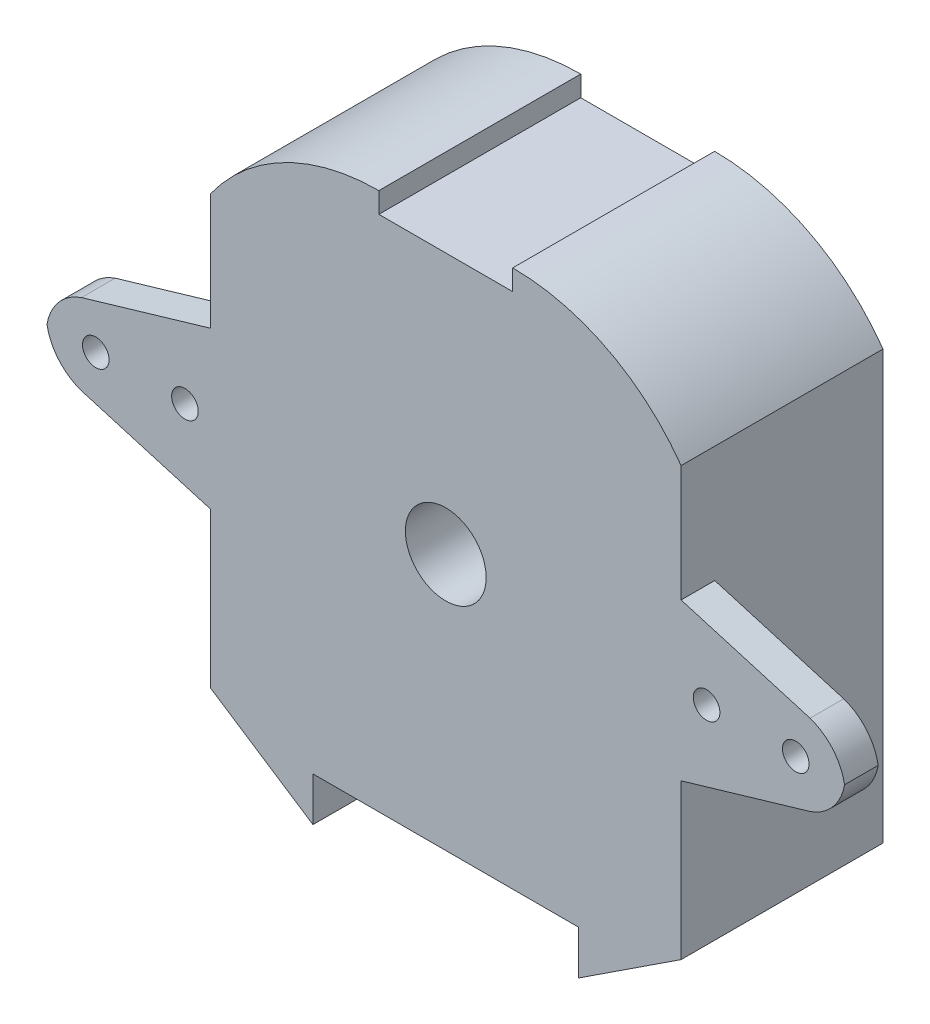
from build123d import *

# Parameters (mm, degrees)
BOSS_EXTRUDE2_DEPTH     = 15.24
SKETCH5_R               = 3.048
CUT_EXTRUDE2_DEPTH      = 15.24
BOSS_EXTRUDE3_DEPTH     = 2.54
CUT_EXTRUDE5_DEPTH      = 41.652633663
CUT_EXTRUDE5_DEPTH_BACK = 41.652633663
SKETCH7_R               = 1.0033


with BuildPart() as part:
    # Sketch1 → Boss-Extrude2 (new body)
    with BuildSketch(Plane.XY):
        with BuildLine():
            Line((-17.763499893, 14.683044609), (-17.763499893, -17.608986031))
            Line((-17.763499893, -17.608986031), (-10.024087591, -22.679635471))
            Line((-10.024087591, -22.679635471), (-10.024087591, -19.359490178))
            Line((-10.024087591, -19.359490178), (10.024087591, -19.359490178))
            Line((10.024087591, -19.359490178), (10.024087591, -22.679635471))
            Line((10.024087591, -22.679635471), (17.763499893, -17.608986031))
            Line((17.763499893, -17.608986031), (17.763499893, 14.683044609))
            ThreePointArc((17.763499893, 14.683044609), (12.2054587, 19.511759091), (5.051122326, 21.250660037))
            Line((5.051122326, 21.250660037), (5.051122326, 19.699745061))
            Line((5.051122326, 19.699745061), (-5.051122326, 19.699745061))
            Line((-5.051122326, 19.699745061), (-5.051122326, 21.250660037))
            ThreePointArc((-5.051122326, 21.250660037), (-12.2054587, 19.511759091), (-17.763499893, 14.683044609))
        make_face()
    extrude(amount=BOSS_EXTRUDE2_DEPTH)

    # Sketch5 → Cut-Extrude2 (cut)
    with BuildSketch(Plane.XY.offset(15.24)):
        Circle(SKETCH5_R)
    extrude(amount=-CUT_EXTRUDE2_DEPTH, mode=Mode.SUBTRACT)

    # Sketch6 → Boss-Extrude3 (add)
    with BuildSketch(Plane.XY.offset(15.24)):
        with BuildLine():
            Line((-27.497120647, 3.03730764), (-17.763499893, 5.900096548))
            Line((-17.763499893, 5.900096548), (-17.763499893, -5.920973667))
            Line((-17.763499893, -5.920973667), (-27.497120647, -3.058184758))
            ThreePointArc((-27.497120647, -3.058184758), (-29.216566103, -1.891287663), (-30.10005247, -0.010438559))
            ThreePointArc((-30.10005247, -0.010438559), (-29.216566103, 1.870410544), (-27.497120647, 3.03730764))
        make_face()
        with BuildLine():
            Line((27.497120647, 3.03730764), (17.763499893, 5.900096548))
            Line((17.763499893, 5.900096548), (17.763499893, -5.920973667))
            Line((17.763499893, -5.920973667), (27.497120647, -3.058184758))
            ThreePointArc((27.497120647, -3.058184758), (29.216566103, -1.891287663), (30.10005247, -0.010438559))
            ThreePointArc((30.10005247, -0.010438559), (29.216566103, 1.870410544), (27.497120647, 3.03730764))
        make_face()
    extrude(amount=-BOSS_EXTRUDE3_DEPTH)

    # Sketch7 → Cut-Extrude5 (cut, two sides: drawn at the far end of the back side and taken through both)
    with BuildSketch(Plane(origin=(0, 0, 0), x_dir=(-1, 0, 0), z_dir=(0, 0, -1)).offset(-CUT_EXTRUDE5_DEPTH_BACK)):
        with Locations((-19.685, 0)):
            Circle(SKETCH7_R)
        with Locations((-26.416, 0)):
            Circle(SKETCH7_R)
        with Locations((19.685, 0)):
            Circle(SKETCH7_R)
        with Locations((26.416, 0)):
            Circle(SKETCH7_R)
    extrude(amount=CUT_EXTRUDE5_DEPTH + CUT_EXTRUDE5_DEPTH_BACK, mode=Mode.SUBTRACT)


solid = part.part
